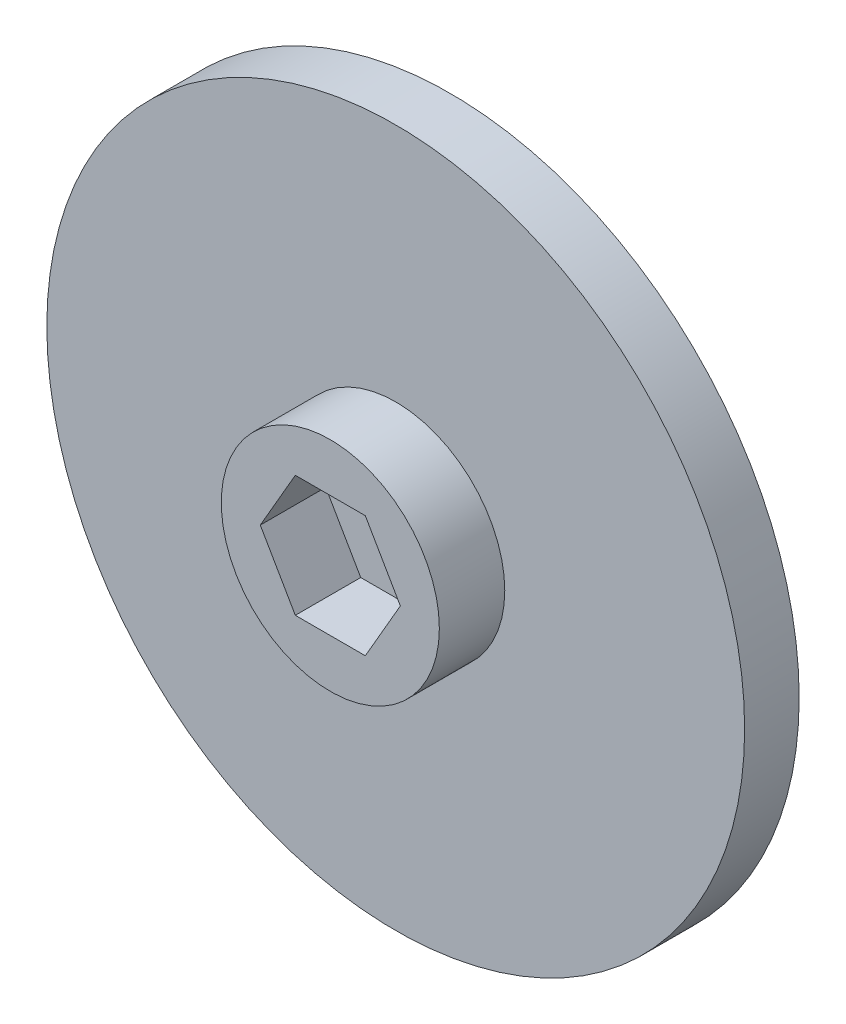
from build123d import *

# Parameters (mm, degrees)
SKETCH1_R           = 64
SKETCH1_R_2         = 5
BOSS_EXTRUDE1_DEPTH = 10
SKETCH2_R           = 20
BOSS_EXTRUDE2_DEPTH = 12


with BuildPart() as part:
    # Sketch1 → Boss-Extrude1 (new body)
    with BuildSketch(Plane.XY):
        Circle(SKETCH1_R)
        Circle(SKETCH1_R_2, mode=Mode.SUBTRACT)
    extrude(amount=BOSS_EXTRUDE1_DEPTH)

    # Sketch2 → Boss-Extrude2 (add)
    with BuildSketch(Plane.XY.offset(10)):
        Circle(SKETCH2_R)
        Polygon((12.843468331, 0), (6.421734166, 11.122769847), (-6.421734166, 11.122769847), (-12.843468331, 0), (-6.421734166, -11.122769847), (6.421734166, -11.122769847), align=None, mode=Mode.SUBTRACT)
    extrude(amount=BOSS_EXTRUDE2_DEPTH)


solid = part.part
